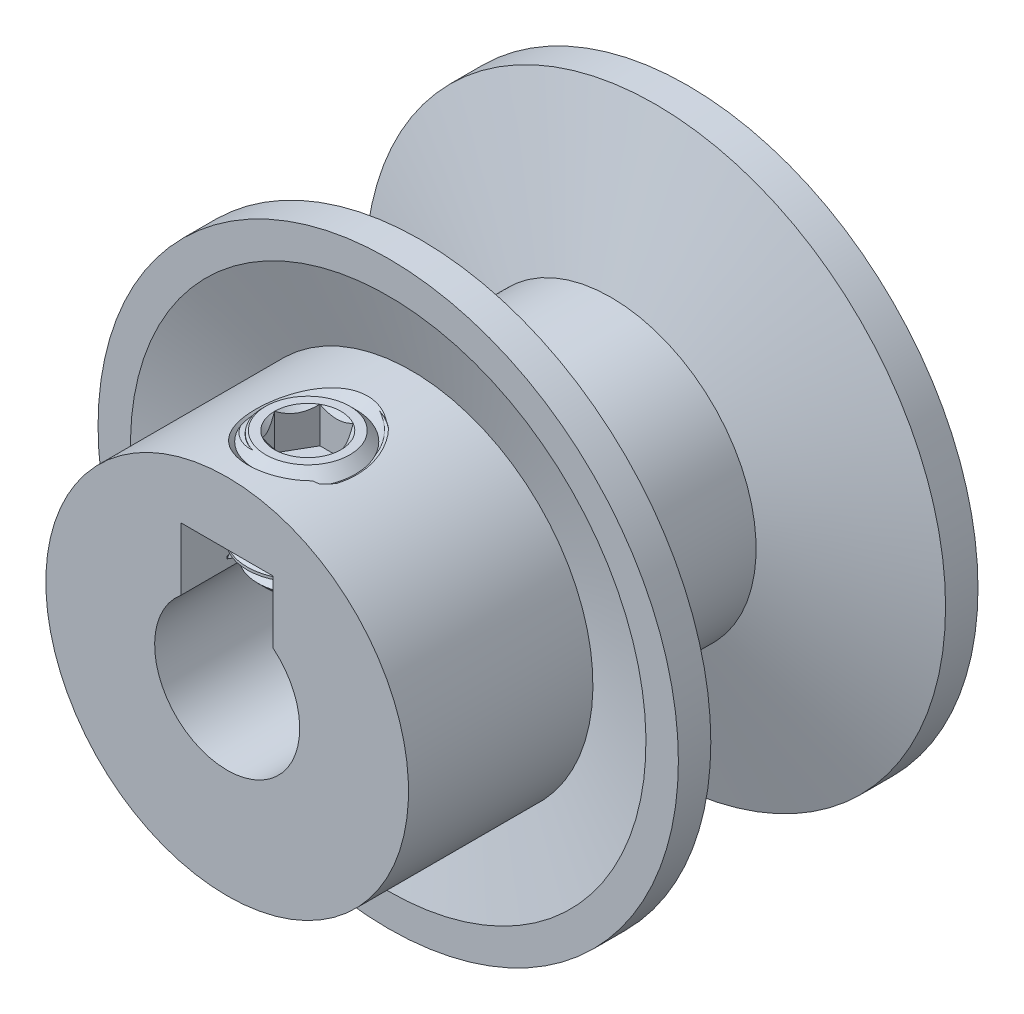
from build123d import *

# Parameters (mm, degrees)
SKETCH2_W          = 11.1125
SKETCH2_H          = 12.5
SKETCH3_R          = 5
CUT_EXTRUDE1_DEPTH = 31.75
SKETCH4_W          = 6.35
SKETCH4_H          = 6.35
CUT_EXTRUDE2_DEPTH = 31.75
CUT_EXTRUDE3_REACH = 45.764
SKETCH5_R          = 3.086805556
CUT_SWEEP1_PITCH   = 1.411111111
CUT_SWEEP2_PITCH   = 1.411111111
CUT_EXTRUDE5_DEPTH = 2.48046875


with BuildPart() as part:
    # Sketch1 → Revolve1 (revolve)
    with BuildSketch(Plane(origin=(0, 0, 0), x_dir=(0, 0, -1), z_dir=(1, 0, 0)), mode=Mode.PRIVATE) as revolve1_sk:
        Polygon((8.0899, 20), (10.3251, 20), (10.3251, 17.7648), (6.774099281, 6.15), (6.35635, 6.15), (6.35635, 0), (-10.3251, 0), (-10.3251, 12.5), (-8.715489108, 12.5), (-10.3251, 17.7648), (-10.3251, 20), (-8.0899, 20), (-5.032593185, 10), (5.032593185, 10), align=None)
    revolve(revolve1_sk.sketch.rotate(Axis((0, 0, 21.4249), (0, 0, -1)), 180), axis=Axis((0, 0, 21.4249), (0, 0, -1)))

    # Sketch2 → Revolve2 (revolve)
    with BuildSketch(Plane(origin=(0, 0, 0), x_dir=(0, 0, -1), z_dir=(1, 0, 0)), mode=Mode.PRIVATE) as revolve2_sk:
        with Locations((-15.86865, 6.25)):
            Rectangle(SKETCH2_W, SKETCH2_H)
    revolve(revolve2_sk.sketch.rotate(Axis((0, 0, -10.3251), (0, 0, 1)), 180), axis=Axis((0, 0, -10.3251), (0, 0, 1)))

    # Sketch3 → Cut-Extrude1 (cut)
    with BuildSketch(Plane(origin=(0, 0, 21.4249), x_dir=(-1, 0, 0), z_dir=(0, 0, -1))):
        with Locations(Location((0, 0, 0), (0, 0, 270))):
            Circle(SKETCH3_R)
    extrude(amount=CUT_EXTRUDE1_DEPTH, mode=Mode.SUBTRACT)

    # Sketch4 → Cut-Extrude2 (cut)
    with BuildSketch(Plane(origin=(0, 0, 21.4249), x_dir=(-1, 0, 0), z_dir=(0, 0, -1))):
        with Locations((0, 5)):
            Rectangle(SKETCH4_W, SKETCH4_H)
    extrude(amount=CUT_EXTRUDE2_DEPTH, mode=Mode.SUBTRACT)

    # Sketch5 → Cut-Extrude3 (cut, up to next)
    with BuildSketch(Plane(origin=(0, 12.5, 0), x_dir=(-1, 0, 0), z_dir=(0, 1, 0)), mode=Mode.PRIVATE) as cut_extrude3_sk1:
        with Locations(Location((0, 15.86865, 0), (0, 0, 90))):
            Circle(SKETCH5_R)
    cut_extrude3_tool1 = extrude(cut_extrude3_sk1.sketch, amount=-CUT_EXTRUDE3_REACH, mode=Mode.PRIVATE) & part.part
    add(cut_extrude3_tool1.solids().sort_by_distance((0, 12.5, 15.86865))[0], mode=Mode.SUBTRACT)

    # Cut-Sweep1: the profile of Sketch7 screwed along a right-hand helix of 9.858268 turns, 8 arcs to a turn; built about Z, then put on its axis
    cut_sweep1_z = Axis((0, 0, 0), (0, 0, 1))
    cut_sweep1_corners = [(2.975827818, 0, -1.367013889), (2.975827818, 0, -0.044097222), (3.96875, 0, -0.617361111), (3.96875, 0, -0.79375)]
    with BuildLine(mode=Mode.PRIVATE) as cut_sweep1_profile:
        Line(cut_sweep1_corners[0], cut_sweep1_corners[1])
        Line(cut_sweep1_corners[1], cut_sweep1_corners[2])
        Line(cut_sweep1_corners[2], cut_sweep1_corners[3])
        Line(cut_sweep1_corners[3], cut_sweep1_corners[0])
    cut_sweep1_cap = Face(cut_sweep1_profile.wire())
    cut_sweep1_turn_angles = [0, 22.5, 45, 67.5, 90, 112.5, 135, 157.5, 180, 202.5, 225, 247.5, 270, 292.5, 315, 337.5, 360]
    cut_sweep1_turn_weights = [1, 0.9238795325112867, 1, 0.9238795325112867, 1, 0.9238795325112867, 1, 0.9238795325112867, 1, 0.9238795325112867, 1, 0.9238795325112867, 1, 0.9238795325112867, 1, 0.9238795325112867, 1]
    cut_sweep1_turn_rails = [Edge.make_bspline([Vector(p[0], p[1], 0).rotate(cut_sweep1_z, cut_sweep1_turn_angles[k]) / cut_sweep1_turn_weights[k] + Vector(0, 0, p[2] + CUT_SWEEP1_PITCH * cut_sweep1_turn_angles[k] / 360) for k in range(17)], [0, 0, 0, 1, 1, 2, 2, 3, 3, 4, 4, 5, 5, 6, 6, 7, 7, 8, 8, 8], 2, cut_sweep1_turn_weights) for p in cut_sweep1_corners]
    cut_sweep1_turn_sides = [Face.make_surface_from_curves(cut_sweep1_turn_rails[p[0]], cut_sweep1_turn_rails[p[1]]) for p in [(0, 1), (1, 2), (2, 3), (3, 0)]]
    cut_sweep1_last_angles = [3240, 3262.5, 3285, 3307.5, 3330, 3352.5, 3375, 3397.5, 3420, 3442.5, 3465, 3487.5, 3510, 3529.488188976, 3548.976377953]
    cut_sweep1_last_weights = [1, 0.9238795325112867, 1, 0.9238795325112867, 1, 0.9238795325112867, 1, 0.9238795325112867, 1, 0.9238795325112867, 1, 0.9238795325112867, 1, 0.9427102824265625, 1]
    cut_sweep1_last_rails = [Edge.make_bspline([Vector(p[0], p[1], 0).rotate(cut_sweep1_z, cut_sweep1_last_angles[k]) / cut_sweep1_last_weights[k] + Vector(0, 0, p[2] + CUT_SWEEP1_PITCH * cut_sweep1_last_angles[k] / 360) for k in range(15)], [0, 0, 0, 1, 1, 2, 2, 3, 3, 4, 4, 5, 5, 6, 6, 7, 7, 7], 2, cut_sweep1_last_weights) for p in cut_sweep1_corners]
    cut_sweep1_last_sides = [Face.make_surface_from_curves(cut_sweep1_last_rails[p[0]], cut_sweep1_last_rails[p[1]]) for p in [(0, 1), (1, 2), (2, 3), (3, 0)]]
    cut_sweep1 = Plane(origin=(0, 12.5, 15.86865), x_dir=(0, 0, 1), z_dir=(0, -1, 0)) * Solid(Shell([*[p.moved(Location((0, 0, CUT_SWEEP1_PITCH * i))) for i in range(9) for p in cut_sweep1_turn_sides], *cut_sweep1_last_sides, cut_sweep1_cap, cut_sweep1_cap.rotate(cut_sweep1_z, 3548.976377953).moved(Location((0, 0, CUT_SWEEP1_PITCH * 3548.976377953 / 360)))]))
    add(cut_sweep1, mode=Mode.SUBTRACT)

    # Cut-Extrude4 cone 1 section (through the dimple's axis) → Cut-Extrude4 (revolve, cut)
    with BuildSketch(Plane(origin=(0, 12.5, 15.86865), x_dir=(0, 0, 1), z_dir=(1, 0, 0))):
        Polygon((0, 0), (4.121507259, 0), (0, 4.121507259), align=None)
    revolve(axis=Axis((0, 12.5, 15.86865), (0, -1, 0)), mode=Mode.SUBTRACT)


with BuildPart() as body_2:
    # Sketch9 → Revolve3 (revolve)
    with BuildSketch(Plane(origin=(0, 0, 0), x_dir=(0, 0, -1), z_dir=(1, 0, 0))):
        Polygon((-19.8374, 5.631800811), (-19.8374, 11.430699189), (-18.768099189, 12.5), (-15.86865, 12.5), (-15.86865, 4.5625), (-18.768099189, 4.5625), align=None)
    revolve(axis=Axis((0, 12.5, 15.86865), (0, -1, 0)))

    # Cut-Sweep2: the profile of Sketch11 profile screwed along a right-hand helix of 6.625 turns, 8 arcs to a turn; built about Z, then put on its axis
    cut_sweep2_z = Axis((0, 0, 0), (0, 0, 1))
    cut_sweep2_corners = [(3.052206448, 0, -0.088194444), (3.052206448, 0, 0.088194444), (3.96905, 0, 0.617534316), (3.96905, 0, -0.617534316)]
    with BuildLine(mode=Mode.PRIVATE) as cut_sweep2_profile:
        Line(cut_sweep2_corners[0], cut_sweep2_corners[1])
        Line(cut_sweep2_corners[1], cut_sweep2_corners[2])
        Line(cut_sweep2_corners[2], cut_sweep2_corners[3])
        Line(cut_sweep2_corners[3], cut_sweep2_corners[0])
    cut_sweep2_cap = Face(cut_sweep2_profile.wire())
    cut_sweep2_turn_angles = [0, 22.5, 45, 67.5, 90, 112.5, 135, 157.5, 180, 202.5, 225, 247.5, 270, 292.5, 315, 337.5, 360]
    cut_sweep2_turn_weights = [1, 0.9238795325112867, 1, 0.9238795325112867, 1, 0.9238795325112867, 1, 0.9238795325112867, 1, 0.9238795325112867, 1, 0.9238795325112867, 1, 0.9238795325112867, 1, 0.9238795325112867, 1]
    cut_sweep2_turn_rails = [Edge.make_bspline([Vector(p[0], p[1], 0).rotate(cut_sweep2_z, cut_sweep2_turn_angles[k]) / cut_sweep2_turn_weights[k] + Vector(0, 0, p[2] + CUT_SWEEP2_PITCH * cut_sweep2_turn_angles[k] / 360) for k in range(17)], [0, 0, 0, 1, 1, 2, 2, 3, 3, 4, 4, 5, 5, 6, 6, 7, 7, 8, 8, 8], 2, cut_sweep2_turn_weights) for p in cut_sweep2_corners]
    cut_sweep2_turn_sides = [Face.make_surface_from_curves(cut_sweep2_turn_rails[p[0]], cut_sweep2_turn_rails[p[1]]) for p in [(0, 1), (1, 2), (2, 3), (3, 0)]]
    cut_sweep2_last_angles = [2160, 2182.5, 2205, 2227.5, 2250, 2272.5, 2295, 2317.5, 2340, 2362.5, 2385]
    cut_sweep2_last_weights = [1, 0.9238795325112867, 1, 0.9238795325112867, 1, 0.9238795325112867, 1, 0.9238795325112867, 1, 0.9238795325112655, 1]
    cut_sweep2_last_rails = [Edge.make_bspline([Vector(p[0], p[1], 0).rotate(cut_sweep2_z, cut_sweep2_last_angles[k]) / cut_sweep2_last_weights[k] + Vector(0, 0, p[2] + CUT_SWEEP2_PITCH * cut_sweep2_last_angles[k] / 360) for k in range(11)], [0, 0, 0, 1, 1, 2, 2, 3, 3, 4, 4, 5, 5, 5], 2, cut_sweep2_last_weights) for p in cut_sweep2_corners]
    cut_sweep2_last_sides = [Face.make_surface_from_curves(cut_sweep2_last_rails[p[0]], cut_sweep2_last_rails[p[1]]) for p in [(0, 1), (1, 2), (2, 3), (3, 0)]]
    cut_sweep2 = Plane(origin=(0, 12.5, 15.86865), x_dir=(0, 0, 1), z_dir=(0, -1, 0)) * Solid(Shell([*[p.moved(Location((0, 0, CUT_SWEEP2_PITCH * i))) for i in range(6) for p in cut_sweep2_turn_sides], *cut_sweep2_last_sides, cut_sweep2_cap, cut_sweep2_cap.rotate(cut_sweep2_z, 2385).moved(Location((0, 0, CUT_SWEEP2_PITCH * 2385 / 360)))]))
    add(cut_sweep2, mode=Mode.SUBTRACT)

    # Sketch12 → Cut-Extrude5 (cut)
    with BuildSketch(Plane(origin=(0, 12.5, 0), x_dir=(1, 0, 0), z_dir=(0, 1, 0))):
        Polygon((2.291358881, -15.86865), (1.14567944, -13.884275), (-1.14567944, -13.884275), (-2.291358881, -15.86865), (-1.14567944, -17.853025), (1.14567944, -17.853025), align=None)
    extrude(amount=-CUT_EXTRUDE5_DEPTH, mode=Mode.SUBTRACT)

    # Cut-Extrude6 cone 1 section (through the dimple's axis) → Cut-Extrude6 (revolve, cut)
    with BuildSketch(Plane(origin=(0, 12.5, 15.86865), x_dir=(0, 0, 1), z_dir=(1, 0, 0))):
        Polygon((0, 0), (2.291358881, 0), (0, 2.291358881), align=None)
    revolve(axis=Axis((0, 12.5, 15.86865), (0, -1, 0)), mode=Mode.SUBTRACT)


solid = Compound([part.part, body_2.part])
